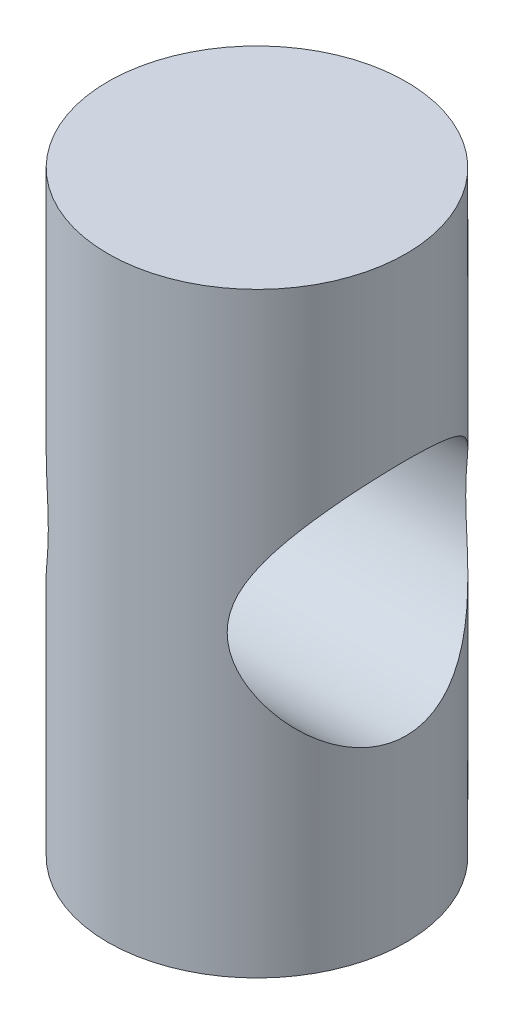
from build123d import *

# Parameters (mm, degrees)
SKETCH_1_R               = 5
EXTRUDE_1_DEPTH          = 20
CUT_EXTRUDE_1_DEPTH      = 22.213203436
CUT_EXTRUDE_1_DEPTH_BACK = 22.213203436
SKETCH_2_R               = 4


with BuildPart() as part:
    # 草图1 → 凸台-拉伸1 (new body)
    with BuildSketch(Plane(origin=(0, 0, 0), x_dir=(1, 0, 0), z_dir=(0, 1, 0))):
        Circle(SKETCH_1_R)
    extrude(amount=EXTRUDE_1_DEPTH)

    # 草图2 → 切除-拉伸1 (cut, two sides: drawn at the far end of the back side and taken through both)
    with BuildSketch(Plane(origin=(0, 0, 0), x_dir=(0, 0, -1), z_dir=(1, 0, 0)).offset(-CUT_EXTRUDE_1_DEPTH_BACK)):
        with Locations((0, 10)):
            Circle(SKETCH_2_R)
    extrude(amount=CUT_EXTRUDE_1_DEPTH + CUT_EXTRUDE_1_DEPTH_BACK, mode=Mode.SUBTRACT)


solid = part.part
